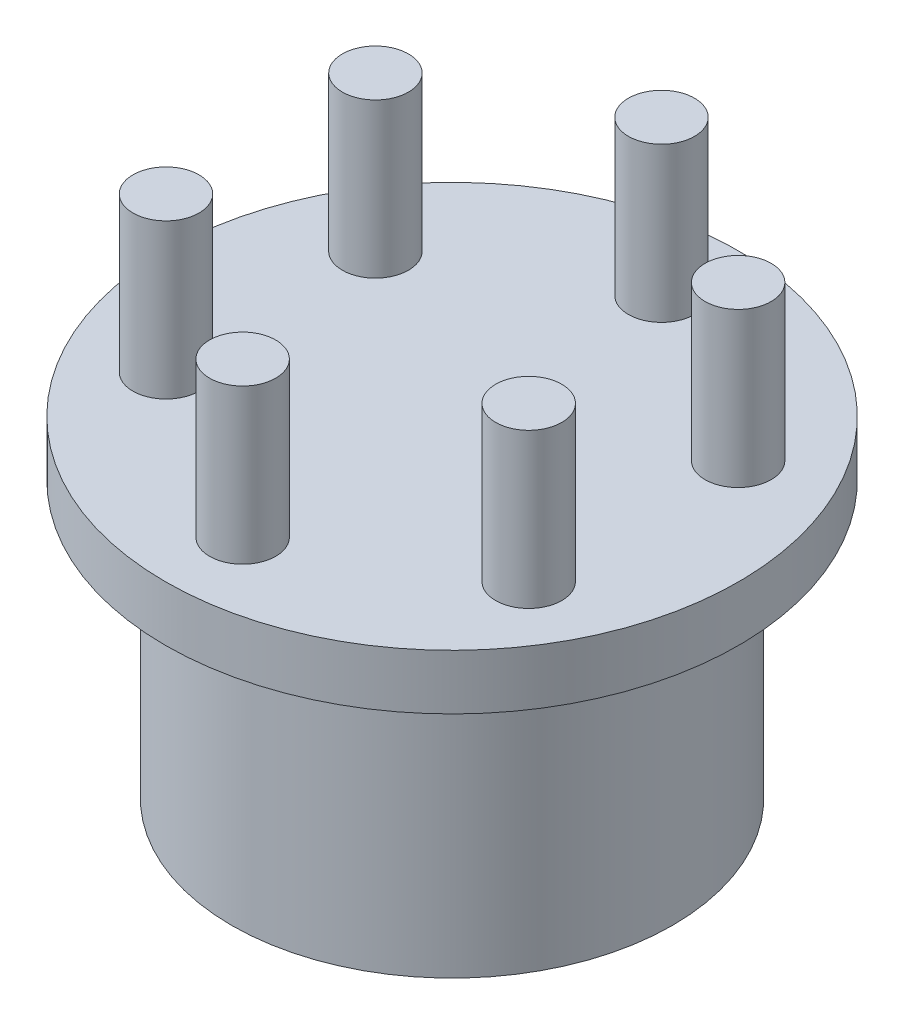
from build123d import *

# Parameters (mm, degrees)
SKETCH1_R           = 26
BOSS_EXTRUDE1_DEPTH = 5
SKETCH2_R           = 3
BOSS_EXTRUDE3_DEPTH = 14
SKETCH4_R           = 20
BOSS_EXTRUDE4_DEPTH = 30
CUT_EXTRUDE3_DEPTH  = 20


with BuildPart() as part:
    # Sketch1 → Boss-Extrude1 (new body)
    with BuildSketch(Plane(origin=(0, 0, 0), x_dir=(1, 0, 0), z_dir=(0, 1, 0))):
        Circle(SKETCH1_R)
    extrude(amount=BOSS_EXTRUDE1_DEPTH)

    # Sketch2 → Boss-Extrude3 (add)
    with BuildSketch(Plane(origin=(0, 5, 0), x_dir=(1, 0, 0), z_dir=(0, 1, 0))):
        with Locations((0, 19)):
            Circle(SKETCH2_R)
        with Locations((16.454482672, 9.5)):
            Circle(SKETCH2_R)
        with Locations((16.454482672, -9.5)):
            Circle(SKETCH2_R)
        with Locations((0, -19)):
            Circle(SKETCH2_R)
        with Locations((-16.454482672, -9.5)):
            Circle(SKETCH2_R)
        with Locations((-16.454482672, 9.5)):
            Circle(SKETCH2_R)
    extrude(amount=BOSS_EXTRUDE3_DEPTH)

    # Sketch4 → Boss-Extrude4 (add)
    with BuildSketch(Plane(origin=(0, 5, 0), x_dir=(1, 0, 0), z_dir=(0, 1, 0))):
        Circle(SKETCH4_R)
    extrude(amount=-BOSS_EXTRUDE4_DEPTH)

    # Sketch10 → Cut-Extrude3 (cut)
    with BuildSketch(Plane.XZ.offset(25)):
        with BuildLine():
            Line((16.5, 4), (16.5, -4))
            Line((16.5, -4), (11.842719282, -4))
            ThreePointArc((11.842719282, -4), (8.838834765, -8.838834765), (4, -11.842719282))
            Line((4, -11.842719282), (4, -16.5))
            Line((4, -16.5), (-4, -16.5))
            Line((-4, -16.5), (-4, -11.842719282))
            ThreePointArc((-4, -11.842719282), (-8.838834765, -8.838834765), (-11.842719282, -4))
            Line((-11.842719282, -4), (-16.5, -4))
            Line((-16.5, -4), (-16.5, 4))
            Line((-16.5, 4), (-11.842719282, 4))
            ThreePointArc((-11.842719282, 4), (-8.838834765, 8.838834765), (-4, 11.842719282))
            Line((-4, 11.842719282), (-4, 16.5))
            Line((-4, 16.5), (4, 16.5))
            Line((4, 16.5), (4, 11.842719282))
            ThreePointArc((4, 11.842719282), (8.838834765, 8.838834765), (11.842719282, 4))
            Line((11.842719282, 4), (16.5, 4))
        make_face()
    extrude(amount=-CUT_EXTRUDE3_DEPTH, mode=Mode.SUBTRACT)


solid = part.part
